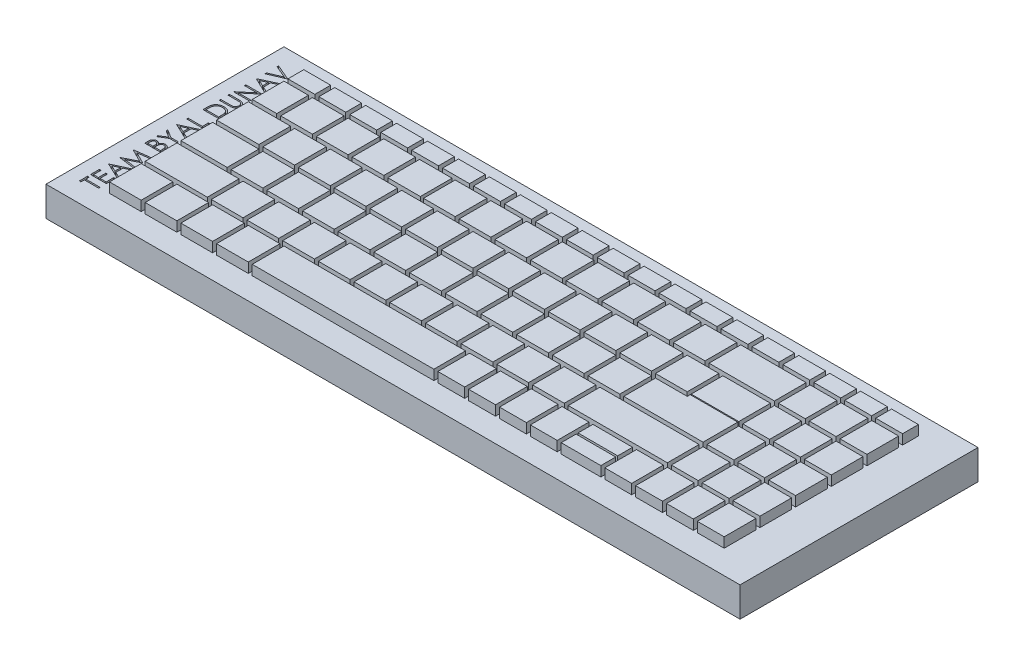
from build123d import *

# Parameters (mm, degrees)
SKETCH2_W           = 350
SKETCH2_H           = 120
BOSS_EXTRUDE1_DEPTH = 15
SKETCH3_W           = 13.55
SKETCH3_H           = 8
SKETCH3_W_2         = 12.35
SKETCH3_H_2         = 16
SKETCH3_W_3         = 21.35
SKETCH3_W_4         = 16
SKETCH3_W_5         = 33
SKETCH3_W_6         = 16.425
SKETCH3_W_7         = 24
BOSS_EXTRUDE2_DEPTH = 5
SKETCH4_W           = 16
SKETCH4_H           = 16
SKETCH4_W_2         = 23.35
BOSS_EXTRUDE3_DEPTH = 5
SKETCH5_W           = 50
SKETCH5_H           = 16
SKETCH5_W_2         = 16
SKETCH5_W_3         = 31.35
BOSS_EXTRUDE4_DEPTH = 5
SKETCH8_W           = 13.55
SKETCH8_H           = 16
SKETCH8_W_2         = 20
SKETCH8_H_2         = 7.5
SKETCH8_W_3         = 91.6
SKETCH8_W_4         = 16
BOSS_EXTRUDE5_DEPTH = 5
CUT_EXTRUDE5_DEPTH  = 5


with BuildPart() as part:
    # Sketch2 → Boss-Extrude1 (new body)
    with BuildSketch(Plane(origin=(0, 0, 0), x_dir=(1, 0, 0), z_dir=(0, 1, 0))):
        Rectangle(SKETCH2_W, SKETCH2_H)
    extrude(amount=BOSS_EXTRUDE1_DEPTH)

    # Sketch3 → Boss-Extrude2 (add)
    with BuildSketch(Plane(origin=(0, 15, 0), x_dir=(1, 0, 0), z_dir=(0, 1, 0))):
        with Locations((-132.625, 46)):
            Rectangle(SKETCH3_W, SKETCH3_H)
        with Locations((-117.025, 46)):
            Rectangle(SKETCH3_W, SKETCH3_H)
        with Locations((-148.225, 46)):
            Rectangle(SKETCH3_W, SKETCH3_H)
        with Locations((-101.425, 46)):
            Rectangle(SKETCH3_W, SKETCH3_H)
        with Locations((-85.825, 46)):
            Rectangle(SKETCH3_W, SKETCH3_H)
        with Locations((-148.825, 32)):
            Rectangle(SKETCH3_W_2, SKETCH3_H_2)
        with Locations((-70.225, 46)):
            Rectangle(SKETCH3_W, SKETCH3_H)
        with Locations((-144.325, 14)):
            Rectangle(SKETCH3_W_3, SKETCH3_H_2)
        with Locations((-54.625, 46)):
            Rectangle(SKETCH3_W, SKETCH3_H)
        with Locations((-39.025, 46)):
            Rectangle(SKETCH3_W, SKETCH3_H)
        with Locations((148.225, -40)):
            Rectangle(SKETCH3_W, SKETCH3_H_2)
        with Locations((-23.425, 46)):
            Rectangle(SKETCH3_W, SKETCH3_H)
        with Locations((148.225, -22)):
            Rectangle(SKETCH3_W, SKETCH3_H_2)
        with Locations((-7.825, 46)):
            Rectangle(SKETCH3_W, SKETCH3_H)
        with Locations((148.225, -4)):
            Rectangle(SKETCH3_W, SKETCH3_H_2)
        with Locations((7.774999999, 46)):
            Rectangle(SKETCH3_W, SKETCH3_H)
        with Locations((148.225, 14)):
            Rectangle(SKETCH3_W, SKETCH3_H_2)
        with Locations((23.374999999, 46)):
            Rectangle(SKETCH3_W, SKETCH3_H)
        with Locations((148.225, 32)):
            Rectangle(SKETCH3_W, SKETCH3_H_2)
        with Locations((38.974999999, 46)):
            Rectangle(SKETCH3_W, SKETCH3_H)
        with Locations((148.174999999, 46)):
            Rectangle(SKETCH3_W, SKETCH3_H)
        with Locations((54.574999999, 46)):
            Rectangle(SKETCH3_W, SKETCH3_H)
        with Locations((132.574999999, 46)):
            Rectangle(SKETCH3_W, SKETCH3_H)
        with Locations((70.174999999, 46)):
            Rectangle(SKETCH3_W, SKETCH3_H)
        with Locations((116.974999999, 46)):
            Rectangle(SKETCH3_W, SKETCH3_H)
        with Locations((85.774999999, 46)):
            Rectangle(SKETCH3_W, SKETCH3_H)
        with Locations((101.374999999, 46)):
            Rectangle(SKETCH3_W, SKETCH3_H)
        with Locations((47.35, 32)):
            Rectangle(SKETCH3_W_4, SKETCH3_H_2)
        with Locations((132.675, 32)):
            Rectangle(SKETCH3_W, SKETCH3_H_2)
        with Locations((117.125, 32)):
            Rectangle(SKETCH3_W, SKETCH3_H_2)
        with Locations((91.85, 32)):
            Rectangle(SKETCH3_W_5, SKETCH3_H_2)
        with Locations((65.35, 32)):
            Rectangle(SKETCH3_W_4, SKETCH3_H_2)
        with Locations((29.35, 32)):
            Rectangle(SKETCH3_W_4, SKETCH3_H_2)
        with Locations((11.35, 32)):
            Rectangle(SKETCH3_W_4, SKETCH3_H_2)
        with Locations((-6.65, 32)):
            Rectangle(SKETCH3_W_4, SKETCH3_H_2)
        with Locations((-24.65, 32)):
            Rectangle(SKETCH3_W_4, SKETCH3_H_2)
        with Locations((-42.65, 32)):
            Rectangle(SKETCH3_W_4, SKETCH3_H_2)
        with Locations((-60.65, 32)):
            Rectangle(SKETCH3_W_4, SKETCH3_H_2)
        with Locations((-78.4375, 32)):
            Rectangle(SKETCH3_W_6, SKETCH3_H_2)
        with Locations((-96.65, 32)):
            Rectangle(SKETCH3_W_4, SKETCH3_H_2)
        with Locations((-114.65, 32)):
            Rectangle(SKETCH3_W_4, SKETCH3_H_2)
        with Locations((-132.65, 32)):
            Rectangle(SKETCH3_W_4, SKETCH3_H_2)
        with Locations((117.125, 14)):
            Rectangle(SKETCH3_W, SKETCH3_H_2)
        with Locations((132.675, 14)):
            Rectangle(SKETCH3_W, SKETCH3_H_2)
        with Locations((117.125, -4)):
            Rectangle(SKETCH3_W, SKETCH3_H_2)
        with Locations((132.675, -4)):
            Rectangle(SKETCH3_W, SKETCH3_H_2)
        with Locations((117.125, -22)):
            Rectangle(SKETCH3_W, SKETCH3_H_2)
        with Locations((132.675, -22)):
            Rectangle(SKETCH3_W, SKETCH3_H_2)
        with Locations((117.125, -40)):
            Rectangle(SKETCH3_W, SKETCH3_H_2)
        with Locations((132.675, -40)):
            Rectangle(SKETCH3_W, SKETCH3_H_2)
        with Locations((56.35, 14)):
            Rectangle(SKETCH3_W_4, SKETCH3_H_2)
        with Locations((96.35, 14)):
            Rectangle(SKETCH3_W_7, SKETCH3_H_2)
        with Locations((74.35, 14)):
            Rectangle(SKETCH3_W_4, SKETCH3_H_2)
        with Locations((38.35, 14)):
            Rectangle(SKETCH3_W_4, SKETCH3_H_2)
        with Locations((20.35, 14)):
            Rectangle(SKETCH3_W_4, SKETCH3_H_2)
        with Locations((2.35, 14)):
            Rectangle(SKETCH3_W_4, SKETCH3_H_2)
        with Locations((-15.65, 14)):
            Rectangle(SKETCH3_W_4, SKETCH3_H_2)
        with Locations((-33.65, 14)):
            Rectangle(SKETCH3_W_4, SKETCH3_H_2)
        with Locations((-51.65, 14)):
            Rectangle(SKETCH3_W_4, SKETCH3_H_2)
        with Locations((-69.65, 14)):
            Rectangle(SKETCH3_W_4, SKETCH3_H_2)
        with Locations((-87.65, 14)):
            Rectangle(SKETCH3_W_4, SKETCH3_H_2)
        with Locations((-105.65, 14)):
            Rectangle(SKETCH3_W_4, SKETCH3_H_2)
        with Locations((-123.65, 14)):
            Rectangle(SKETCH3_W_4, SKETCH3_H_2)
    extrude(amount=BOSS_EXTRUDE2_DEPTH)

    # Sketch4 → Boss-Extrude3 (add)
    with BuildSketch(Plane(origin=(0, 15, 0), x_dir=(1, 0, 0), z_dir=(0, 1, 0))):
        Polygon((84.35, 4), (68.35, 4), (68.35, -12), (108.35, -12), (108.35, 4), (108.35, 5.49921677), (84.35, 5.49921677), align=None)
        with Locations((40.35, -4)):
            Rectangle(SKETCH4_W, SKETCH4_H)
        with Locations((58.35, -4)):
            Rectangle(SKETCH4_W, SKETCH4_H)
        with Locations((22.35, -4)):
            Rectangle(SKETCH4_W, SKETCH4_H)
        with Locations((4.35, -4)):
            Rectangle(SKETCH4_W, SKETCH4_H)
        with Locations((-13.65, -4)):
            Rectangle(SKETCH4_W, SKETCH4_H)
        with Locations((-31.65, -4)):
            Rectangle(SKETCH4_W, SKETCH4_H)
        with Locations((-49.65, -4)):
            Rectangle(SKETCH4_W, SKETCH4_H)
        with Locations((-67.65, -4)):
            Rectangle(SKETCH4_W, SKETCH4_H)
        with Locations((-85.65, -4)):
            Rectangle(SKETCH4_W, SKETCH4_H)
        with Locations((-103.65, -4)):
            Rectangle(SKETCH4_W, SKETCH4_H)
        with Locations((-121.65, -4)):
            Rectangle(SKETCH4_W, SKETCH4_H)
        with Locations((-143.325, -4)):
            Rectangle(SKETCH4_W_2, SKETCH4_H)
    extrude(amount=BOSS_EXTRUDE3_DEPTH)

    # Sketch5 → Boss-Extrude4 (add)
    with BuildSketch(Plane(origin=(0, 15, 0), x_dir=(1, 0, 0), z_dir=(0, 1, 0))):
        with Locations((83.35, -22)):
            Rectangle(SKETCH5_W, SKETCH5_H)
        with Locations((30.35, -22)):
            Rectangle(SKETCH5_W_2, SKETCH5_H)
        with Locations((48.35, -22)):
            Rectangle(SKETCH5_W_2, SKETCH5_H)
        with Locations((12.35, -22)):
            Rectangle(SKETCH5_W_2, SKETCH5_H)
        with Locations((-5.65, -22)):
            Rectangle(SKETCH5_W_2, SKETCH5_H)
        with Locations((-23.65, -22)):
            Rectangle(SKETCH5_W_2, SKETCH5_H)
        with Locations((-41.65, -22)):
            Rectangle(SKETCH5_W_2, SKETCH5_H)
        with Locations((-59.65, -22)):
            Rectangle(SKETCH5_W_2, SKETCH5_H)
        with Locations((-77.65, -22)):
            Rectangle(SKETCH5_W_2, SKETCH5_H)
        with Locations((-95.65, -22)):
            Rectangle(SKETCH5_W_2, SKETCH5_H)
        with Locations((-113.65, -22)):
            Rectangle(SKETCH5_W_2, SKETCH5_H)
        with Locations((-139.325, -22)):
            Rectangle(SKETCH5_W_3, SKETCH5_H)
    extrude(amount=BOSS_EXTRUDE4_DEPTH)

    # Sketch8 → Boss-Extrude5 (add)
    with BuildSketch(Plane(origin=(0, 15, 0), x_dir=(1, 0, 0), z_dir=(0, 1, 0))):
        with Locations((101.575, -40)):
            Rectangle(SKETCH8_W, SKETCH8_H)
        with Locations((48.475, -40)):
            Rectangle(SKETCH8_W, SKETCH8_H)
        with Locations((82.8, -35.75)):
            Rectangle(SKETCH8_W_2, SKETCH8_H_2)
        with Locations((82.8, -44.25)):
            Rectangle(SKETCH8_W_2, SKETCH8_H_2)
        with Locations((64.025, -40)):
            Rectangle(SKETCH8_W, SKETCH8_H)
        with Locations((32.925, -40)):
            Rectangle(SKETCH8_W, SKETCH8_H)
        with Locations((17.375, -40)):
            Rectangle(SKETCH8_W, SKETCH8_H)
        with Locations((-37.2, -40)):
            Rectangle(SKETCH8_W_3, SKETCH8_H)
        with Locations((-129, -40)):
            Rectangle(SKETCH8_W_4, SKETCH8_H)
        with Locations((-147, -40)):
            Rectangle(SKETCH8_W_4, SKETCH8_H)
        with Locations((-111, -40)):
            Rectangle(SKETCH8_W_4, SKETCH8_H)
        with Locations((-93, -40)):
            Rectangle(SKETCH8_W_4, SKETCH8_H)
    extrude(amount=BOSS_EXTRUDE5_DEPTH)

    # Sketch16 → Cut-Extrude5 (cut)
    # profile 1 of 13: a face of its own
    with BuildSketch(Plane(origin=(0, 15, 0), x_dir=(1, 0, 0), z_dir=(0, 1, 0))):
        Polygon((-168, 43.435897436), (-168, 44.205128205), (-161.695512821, 46.871794872), (-168, 49.538461538), (-168, 50.307692308), (-160, 46.923076923), (-160, 46.820512821), align=None)
    # profile 2 of 13: a face of its own
    with BuildSketch(Plane(origin=(0, 15, 0), x_dir=(1, 0, 0), z_dir=(0, 1, 0))):
        Polygon((-168, 39.128205128), (-160, 42.820512821), (-160, 42.040064103), (-162.564102564, 40.857371795), (-162.564102564, 37.230769231), (-160, 36.014423077), (-160, 35.230769231), (-168, 39.025641026), align=None)
        Polygon((-166.440705128, 39.068910256), (-163.384615385, 37.620192308), (-163.384615385, 40.479166667), align=None, mode=Mode.SUBTRACT)
    # profile 3 of 13: a face of its own
    with BuildSketch(Plane(origin=(0, 15, 0), x_dir=(1, 0, 0), z_dir=(0, 1, 0))):
        Polygon((-160, 27.641025641), (-168, 27.641025641), (-168, 27.791666667), (-161.703525641, 33.076923077), (-168, 33.076923077), (-168, 33.794871795), (-160, 33.794871795), (-160, 33.631410256), (-166.282051282, 28.358974359), (-160, 28.358974359), align=None)
    # profile 4 of 13: a face of its own
    with BuildSketch(Plane(origin=(0, 15, 0), x_dir=(1, 0, 0), z_dir=(0, 1, 0))):
        with BuildLine():
            Line((-168, 20.358974359), (-168, 21.076923077))
            Line((-168, 21.076923077), (-163.206730769, 21.076923077))
            add(Edge.make_bspline(
                [(-163.206730769, 21.076923077), (-163.138889088, 21.076816234), (-163.010147805, 21.07661348), (-162.826905976, 21.077967797), (-162.663997498, 21.081760639), (-162.520794418, 21.084151861), (-162.397953852, 21.089471481), (-162.294810285, 21.093809874), (-162.211852108, 21.099388289), (-162.163438562, 21.106092558), (-162.142628205, 21.108974359)],
                knots=[0, 0, 0, 0, 1.528628734, 2.90083645, 4.128790002, 5.200304208, 6.127813768, 6.898992206, 7.526736466, 8, 8, 8, 8], degree=3))
            add(Edge.make_bspline(
                [(-162.142628205, 21.108974359), (-162.066974247, 21.120673749), (-161.920927682, 21.143258896), (-161.713104437, 21.203263415), (-161.525458912, 21.283259106), (-161.353758487, 21.382498544), (-161.199094336, 21.507888004), (-161.060279395, 21.663562891), (-160.934131896, 21.846732163), (-160.824149413, 22.054771542), (-160.732799693, 22.276437865), (-160.664446658, 22.503784397), (-160.622614644, 22.732423355), (-160.617783612, 22.885515756), (-160.615384615, 22.961538462)],
                knots=[0, 0, 0, 0, 1.042777144, 2.01303441, 2.939567723, 3.817555404, 4.708046775, 5.641195415, 6.651191522, 7.732783915, 8.843021186, 9.914367358, 10.964315445, 12, 12, 12, 12], degree=3))
            add(Edge.make_bspline(
                [(-160.615384615, 22.961538462), (-160.617825524, 23.026809892), (-160.622693244, 23.156975762), (-160.653207727, 23.350276432), (-160.707118043, 23.539135144), (-160.780553735, 23.722068249), (-160.870859951, 23.896102773), (-160.979045328, 24.056776692), (-161.105060341, 24.200766612), (-161.244719756, 24.332165438), (-161.402099767, 24.445914414), (-161.573403563, 24.546486294), (-161.763198883, 24.626358857), (-161.896502149, 24.666798093), (-161.96474359, 24.6875)],
                knots=[0, 0, 0, 0, 0.994718802, 1.98369237, 2.973235266, 3.981451368, 4.982709966, 5.955777334, 6.925228988, 7.892833478, 8.871333226, 9.877970804, 10.913677552, 12, 12, 12, 12], degree=3))
            add(Edge.make_bspline(
                [(-161.96474359, 24.6875), (-161.992968903, 24.694357429), (-162.055866274, 24.709638545), (-162.162200653, 24.723917505), (-162.287662056, 24.738789563), (-162.433151914, 24.74910858), (-162.598182708, 24.759168513), (-162.783614154, 24.765186965), (-162.988772922, 24.767968754), (-163.131943577, 24.768797738), (-163.206730769, 24.769230769)],
                knots=[0, 0, 0, 0, 0.558680831, 1.244966039, 2.062412453, 2.990489873, 4.051219941, 5.244515665, 6.560634259, 8, 8, 8, 8], degree=3))
            Line((-163.206730769, 24.769230769), (-168, 24.769230769))
            Line((-168, 24.769230769), (-168, 25.487179487))
            Line((-168, 25.487179487), (-163.168269231, 25.487179487))
            add(Edge.make_bspline(
                [(-163.168269231, 25.487179487), (-163.081187239, 25.486598558), (-162.911241437, 25.485464839), (-162.66220952, 25.475636099), (-162.425974981, 25.459958898), (-162.202501225, 25.437828632), (-161.992604548, 25.4084391), (-161.794902412, 25.376058537), (-161.610484817, 25.33410132), (-161.43722406, 25.285456472), (-161.271462593, 25.230640372), (-161.11445488, 25.158396236), (-160.961589591, 25.077354638), (-160.814578409, 24.982013468), (-160.674355361, 24.872327602), (-160.537290608, 24.752499232), (-160.407469049, 24.618304755), (-160.283289544, 24.473707855), (-160.167802572, 24.319680733), (-160.067302726, 24.155228838), (-159.985468601, 23.981260092), (-159.912839201, 23.801893949), (-159.861216075, 23.612829999), (-159.821964653, 23.416423302), (-159.799849306, 23.211508873), (-159.796545031, 23.072164504), (-159.794871795, 23.001602564)],
                knots=[0, 0, 0, 0, 1.316707045, 2.569633854, 3.76780728, 4.896239288, 5.964314126, 6.972204208, 7.924543903, 8.822147865, 9.693191779, 10.560896119, 11.431827672, 12.307838457, 13.206132673, 14.12176355, 15.058527151, 16.026630406, 17.00238624, 17.966538933, 18.934743273, 19.906713913, 20.888635248, 21.892958714, 22.933025263, 24, 24, 24, 24], degree=3))
            add(Edge.make_bspline(
                [(-159.794871795, 23.001602564), (-159.796664301, 22.924644053), (-159.800181191, 22.77365173), (-159.820365084, 22.55117268), (-159.858285827, 22.337854077), (-159.906883109, 22.131613986), (-159.972813403, 21.934444918), (-160.05382415, 21.746404975), (-160.146310225, 21.565335068), (-160.255597106, 21.395314658), (-160.374767092, 21.234949014), (-160.505662256, 21.089213311), (-160.643297438, 20.954408035), (-160.792855296, 20.836475102), (-160.951274243, 20.730953896), (-161.119299397, 20.64016963), (-161.296705513, 20.56218912), (-161.420028089, 20.52194654), (-161.482371795, 20.501602564)],
                knots=[0, 0, 0, 0, 1.138939089, 2.234594419, 3.301501784, 4.342532435, 5.367382236, 6.373123747, 7.370098489, 8.372230273, 9.360297234, 10.323289009, 11.268038109, 12.20748145, 13.137029304, 14.081414587, 15.030090602, 16, 16, 16, 16], degree=3))
            add(Edge.make_bspline(
                [(-161.482371795, 20.501602564), (-161.524960536, 20.48976906), (-161.617336465, 20.464101925), (-161.770219868, 20.436615531), (-161.946253965, 20.413509058), (-162.145450807, 20.391782068), (-162.367964788, 20.378961593), (-162.613699453, 20.367721733), (-162.882951937, 20.358895176), (-163.070505115, 20.358947227), (-163.168269231, 20.358974359)],
                knots=[0, 0, 0, 0, 0.625038921, 1.35572334, 2.194682327, 3.136881307, 4.189498639, 5.346923369, 6.617055217, 8, 8, 8, 8], degree=3))
            Line((-163.168269231, 20.358974359), (-168, 20.358974359))
        make_face()
    # profile 5 of 13: a face of its own
    with BuildSketch(Plane(origin=(0, 15, 0), x_dir=(1, 0, 0), z_dir=(0, 1, 0))):
        with BuildLine():
            Line((-160, 12.153846154), (-168, 12.153846154))
            Line((-168, 12.153846154), (-168, 13.769230769))
            add(Edge.make_bspline(
                [(-168, 13.769230769), (-167.998988411, 13.909731314), (-167.997034028, 14.181177634), (-167.984642276, 14.573434657), (-167.962721212, 14.936368971), (-167.930790866, 15.268786935), (-167.891583932, 15.571601134), (-167.842440151, 15.843963667), (-167.784410047, 16.08728285), (-167.734934732, 16.236927286), (-167.711538462, 16.307692308)],
                knots=[0, 0, 0, 0, 1.314313732, 2.53924729, 3.670748893, 4.714932338, 5.66265055, 6.526160246, 7.303039223, 8, 8, 8, 8], degree=3))
            add(Edge.make_bspline(
                [(-167.711538462, 16.307692308), (-167.676279261, 16.400260048), (-167.606560421, 16.583296399), (-167.474843711, 16.843763093), (-167.326215941, 17.089798963), (-167.157256773, 17.319442391), (-166.970172532, 17.53326958), (-166.766299745, 17.733707404), (-166.541109464, 17.915814065), (-166.298609945, 18.082425877), (-166.041908288, 18.23268859), (-165.771424904, 18.363289738), (-165.488552137, 18.471756726), (-165.194071566, 18.56179819), (-164.887337053, 18.632761576), (-164.567991055, 18.681177405), (-164.23729577, 18.7131111), (-164.012896995, 18.71632036), (-163.899038462, 18.717948718)],
                knots=[0, 0, 0, 0, 0.984741985, 1.947153288, 2.898543998, 3.841229145, 4.778974371, 5.722123648, 6.681464302, 7.655713756, 8.646344578, 9.637374342, 10.639946623, 11.656849581, 12.698333139, 13.76849723, 14.867749466, 16, 16, 16, 16], degree=3))
            add(Edge.make_bspline(
                [(-163.899038462, 18.717948718), (-163.800155632, 18.716511077), (-163.605296687, 18.713678055), (-163.318117484, 18.688239635), (-163.03945794, 18.651265131), (-162.77064474, 18.594021461), (-162.509323721, 18.524529235), (-162.258276312, 18.435471128), (-162.015213101, 18.333436834), (-161.783371008, 18.214503572), (-161.563863473, 18.083757049), (-161.356783315, 17.944319806), (-161.166725711, 17.793029512), (-160.98871029, 17.634363903), (-160.827492534, 17.464496779), (-160.680133659, 17.285496248), (-160.549100773, 17.096666666), (-160.43233482, 16.896839124), (-160.327914259, 16.683344875), (-160.240814983, 16.449468443), (-160.165378117, 16.196317655), (-160.105368087, 15.922448856), (-160.056969568, 15.628838852), (-160.024745647, 15.314673161), (-160.002891742, 14.980545514), (-160.00098263, 14.7511064), (-160, 14.633012821)],
                knots=[0, 0, 0, 0, 1.106010661, 2.179509527, 3.223302912, 4.248870533, 5.252098245, 6.246278179, 7.226402005, 8.199283979, 9.158616973, 10.083547221, 10.989831858, 11.874256832, 12.749262829, 13.607058236, 14.46581075, 15.317568432, 16.194266721, 17.121067875, 18.106207572, 19.147242834, 20.255495536, 21.43354536, 22.679031616, 24, 24, 24, 24], degree=3))
            Line((-160, 14.633012821), (-160, 12.153846154))
        make_face()
        with BuildLine():
            Line((-160.820512821, 12.871794872), (-160.820512821, 13.790064103))
            add(Edge.make_bspline(
                [(-160.820512821, 13.790064103), (-160.821079898, 13.922014664), (-160.822170596, 14.175803918), (-160.831741346, 14.540736483), (-160.84738006, 14.874175104), (-160.869265952, 15.176167125), (-160.898222787, 15.446542038), (-160.930508279, 15.685864895), (-160.970731023, 15.893351199), (-161.007190359, 16.018904198), (-161.024038462, 16.076923077)],
                knots=[0, 0, 0, 0, 1.375205317, 2.645023457, 3.804390687, 4.853969522, 5.800190428, 6.637939096, 7.370582563, 8, 8, 8, 8], degree=3))
            add(Edge.make_bspline(
                [(-161.024038462, 16.076923077), (-161.049756304, 16.149947912), (-161.100577719, 16.294253386), (-161.193281014, 16.501981471), (-161.303091204, 16.695712172), (-161.425154479, 16.878819322), (-161.563770422, 17.048714342), (-161.715945788, 17.207377298), (-161.88237583, 17.35461394), (-162.062790673, 17.488156425), (-162.255233937, 17.609115183), (-162.460045973, 17.712953203), (-162.674347431, 17.803382515), (-162.899873205, 17.874986153), (-163.13497031, 17.931442485), (-163.380857827, 17.971015217), (-163.637318171, 17.995582567), (-163.811909715, 17.998511468), (-163.900641026, 18)],
                knots=[0, 0, 0, 0, 0.998590647, 1.973329978, 2.929871262, 3.868367705, 4.809062953, 5.754642869, 6.701828697, 7.672172887, 8.647399344, 9.630604387, 10.631475358, 11.644913558, 12.679592956, 13.747988925, 14.855477812, 16, 16, 16, 16], degree=3))
            add(Edge.make_bspline(
                [(-163.900641026, 18), (-163.994203266, 17.998826772), (-164.178007116, 17.996521954), (-164.447700134, 17.967552102), (-164.707084478, 17.925217118), (-164.956177496, 17.863997264), (-165.195465158, 17.785983827), (-165.423624039, 17.688624646), (-165.643063739, 17.577386659), (-165.848719432, 17.445036175), (-166.043217967, 17.300086247), (-166.221400631, 17.139222523), (-166.383673318, 16.96500072), (-166.532563175, 16.779321064), (-166.662080149, 16.576950552), (-166.77793542, 16.362656402), (-166.876257457, 16.133294867), (-166.928552001, 15.973722991), (-166.955128205, 15.892628205)],
                knots=[0, 0, 0, 0, 1.122418816, 2.205001699, 3.251619955, 4.274784885, 5.280384055, 6.268708349, 7.249350384, 8.229342522, 9.199999885, 10.157847722, 11.105861043, 12.055065948, 13.010012805, 13.98527497, 14.976112212, 16, 16, 16, 16], degree=3))
            add(Edge.make_bspline(
                [(-166.955128205, 15.892628205), (-166.97368004, 15.825539871), (-167.013126332, 15.682891664), (-167.056155755, 15.450115746), (-167.094108895, 15.188138262), (-167.126241557, 14.895796088), (-167.149298291, 14.573422467), (-167.166604153, 14.220769466), (-167.178276456, 13.837684656), (-167.179073501, 13.572124578), (-167.179487179, 13.434294872)],
                knots=[0, 0, 0, 0, 0.674548936, 1.434276114, 2.292660221, 3.240891867, 4.284742987, 5.42552168, 6.663806718, 8, 8, 8, 8], degree=3))
            Line((-167.179487179, 13.434294872), (-167.179487179, 12.871794872))
            Line((-167.179487179, 12.871794872), (-160.820512821, 12.871794872))
        make_face(mode=Mode.SUBTRACT)
    # profile 6 of 13: a face of its own
    with BuildSketch(Plane(origin=(0, 15, 0), x_dir=(1, 0, 0), z_dir=(0, 1, 0))):
        Polygon((-168, 3.948717949), (-168, 4.666666667), (-160.820512821, 4.666666667), (-160.820512821, 7.743589744), (-160, 7.743589744), (-160, 3.948717949), align=None)
    # profile 7 of 13: a face of its own
    with BuildSketch(Plane(origin=(0, 15, 0), x_dir=(1, 0, 0), z_dir=(0, 1, 0))):
        Polygon((-168, -0.974358974), (-160, 2.717948718), (-160, 1.9375), (-162.564102564, 0.754807692), (-162.564102564, -2.871794872), (-160, -4.088141026), (-160, -4.871794872), (-168, -1.076923077), align=None)
        Polygon((-166.440705128, -1.033653846), (-163.384615385, -2.482371795), (-163.384615385, 0.376602564), align=None, mode=Mode.SUBTRACT)
    # profile 8 of 13: a face of its own
    with BuildSketch(Plane(origin=(0, 15, 0), x_dir=(1, 0, 0), z_dir=(0, 1, 0))):
        Polygon((-168, -11.435897436), (-168, -10.613782051), (-164.5625, -8.511217949), (-168, -6.411858974), (-168, -5.58974359), (-163.802884615, -8.153846154), (-160, -8.153846154), (-160, -8.871794872), (-163.802884615, -8.871794872), align=None)
    # profile 9 of 13: a face of its own
    with BuildSketch(Plane(origin=(0, 15, 0), x_dir=(1, 0, 0), z_dir=(0, 1, 0))):
        with BuildLine():
            Line((-168, -17.179487179), (-168, -15.618589744))
            add(Edge.make_bspline(
                [(-168, -15.618589744), (-167.999604609, -15.542180588), (-167.998838243, -15.394080629), (-167.986676567, -15.178738281), (-167.97050877, -14.976969984), (-167.943388159, -14.789132287), (-167.915267664, -14.614002959), (-167.873993509, -14.453359931), (-167.8284047, -14.305857616), (-167.758260132, -14.128737527), (-167.649324733, -13.927770516), (-167.487763184, -13.711768583), (-167.294063933, -13.524006524), (-167.073328358, -13.364353117), (-166.830494212, -13.236227862), (-166.57078615, -13.144707555), (-166.298573449, -13.085911424), (-166.111946474, -13.079940623), (-166.017628205, -13.076923077)],
                knots=[0, 0, 0, 0, 1.00128172, 1.940733171, 2.826250472, 3.653024905, 4.427672124, 5.149348099, 5.824709082, 6.450061444, 7.643590664, 8.808605388, 9.972104426, 11.165284501, 12.367876273, 13.557044126, 14.765369432, 16, 16, 16, 16], degree=3))
            add(Edge.make_bspline(
                [(-166.017628205, -13.076923077), (-165.929283391, -13.079436473), (-165.7556775, -13.084375533), (-165.502196721, -13.131029179), (-165.261151319, -13.205075184), (-165.032747591, -13.30740975), (-164.821237294, -13.439262111), (-164.627275627, -13.597239774), (-164.458193276, -13.787048674), (-164.363702275, -13.929330065), (-164.315705128, -14.001602564)],
                knots=[0, 0, 0, 0, 1.044641374, 2.052818814, 3.038628718, 4.023282556, 5.005660861, 5.98021751, 6.974042014, 8, 8, 8, 8], degree=3))
            add(Edge.make_bspline(
                [(-164.315705128, -14.001602564), (-164.280802404, -13.910730362), (-164.214024846, -13.73686933), (-164.096147506, -13.497473164), (-163.967473121, -13.291970337), (-163.829125175, -13.116346455), (-163.677801452, -12.966935991), (-163.512272516, -12.83753789), (-163.332673879, -12.725670711), (-163.139665623, -12.630472514), (-162.934883966, -12.555693144), (-162.720830115, -12.500731343), (-162.498324644, -12.468220244), (-162.347327976, -12.463785231), (-162.270833333, -12.461538462)],
                knots=[0, 0, 0, 0, 1.272586185, 2.434772614, 3.483318042, 4.437947805, 5.351807173, 6.25737843, 7.180033415, 8.1141739, 9.066731021, 10.025721652, 10.999834114, 12, 12, 12, 12], degree=3))
            add(Edge.make_bspline(
                [(-162.270833333, -12.461538462), (-162.192737308, -12.463770764), (-162.03908119, -12.468162883), (-161.813359707, -12.500581218), (-161.597628861, -12.555433558), (-161.390592679, -12.631119007), (-161.192685245, -12.729219947), (-161.004623509, -12.850331048), (-160.826016214, -12.992752155), (-160.656548137, -13.153711026), (-160.50147952, -13.333087096), (-160.368172804, -13.53077107), (-160.253548027, -13.741347371), (-160.16022462, -13.967508015), (-160.088225674, -14.208675662), (-160.038062213, -14.464716113), (-160.004205433, -14.735207707), (-160.001425597, -14.920831354), (-160, -15.016025641)],
                knots=[0, 0, 0, 0, 0.978680899, 1.925582087, 2.851223405, 3.764209995, 4.683484765, 5.614004905, 6.562443559, 7.542772147, 8.539900013, 9.527881485, 10.525548727, 11.540192123, 12.58875426, 13.674701727, 14.807505862, 16, 16, 16, 16], degree=3))
            Line((-160, -15.016025641), (-160, -17.179487179))
            Line((-160, -17.179487179), (-168, -17.179487179))
        make_face()
        with BuildLine():
            Line((-167.179487179, -16.461538462), (-164.615384615, -16.461538462))
            Line((-164.615384615, -16.461538462), (-164.615384615, -15.979166667))
            add(Edge.make_bspline(
                [(-164.615384615, -15.979166667), (-164.616298725, -15.908655134), (-164.618064971, -15.772412484), (-164.62312444, -15.575109866), (-164.637291391, -15.39196696), (-164.651454295, -15.223299936), (-164.674481859, -15.069374274), (-164.70189264, -14.930531411), (-164.730881445, -14.804590955), (-164.780186051, -14.659361109), (-164.853029482, -14.494599871), (-164.966186292, -14.319072484), (-165.100857183, -14.163612333), (-165.257702254, -14.033909242), (-165.428534115, -13.926819975), (-165.611853024, -13.851800576), (-165.803969924, -13.801787376), (-165.936113094, -13.797200602), (-166.003205128, -13.794871795)],
                knots=[0, 0, 0, 0, 1.156917035, 2.235399477, 3.236897345, 4.169954739, 5.01148057, 5.788325709, 6.491867502, 7.129259015, 8.302032419, 9.437271567, 10.542795419, 11.662606952, 12.764338259, 13.836858145, 14.901724648, 16, 16, 16, 16], degree=3))
            add(Edge.make_bspline(
                [(-166.003205128, -13.794871795), (-166.047612712, -13.79605422), (-166.134723038, -13.798373676), (-166.262122336, -13.81806013), (-166.381830948, -13.84995741), (-166.494997774, -13.893154926), (-166.598810348, -13.952169143), (-166.698229103, -14.020574373), (-166.787299342, -14.105030343), (-166.870309252, -14.200473087), (-166.944602845, -14.309676609), (-167.006143572, -14.434993701), (-167.061919917, -14.573184726), (-167.103209488, -14.727998881), (-167.139517191, -14.896228363), (-167.162329565, -15.080151064), (-167.177009544, -15.278601502), (-167.17864288, -15.41610273), (-167.179487179, -15.487179487)],
                knots=[0, 0, 0, 0, 0.911708768, 1.788416306, 2.640049961, 3.452993646, 4.268229297, 5.087074648, 5.92553149, 6.781184137, 7.681934069, 8.628939405, 9.643570426, 10.73771997, 11.914765019, 13.176320755, 14.540391495, 16, 16, 16, 16], degree=3))
            Line((-167.179487179, -15.487179487), (-167.179487179, -16.461538462))
        make_face(mode=Mode.SUBTRACT)
        with BuildLine():
            Line((-163.794871795, -16.461538462), (-160.820512821, -16.461538462))
            Line((-160.820512821, -16.461538462), (-160.820512821, -15.439102564))
            add(Edge.make_bspline(
                [(-160.820512821, -15.439102564), (-160.821477174, -15.365924102), (-160.823335839, -15.224882264), (-160.827694795, -15.021081714), (-160.844184062, -14.832683027), (-160.859395336, -14.659091873), (-160.885405961, -14.500768964), (-160.909953229, -14.35649647), (-160.946391895, -14.228642724), (-160.996472553, -14.079024262), (-161.076645471, -13.911785403), (-161.193777346, -13.729023434), (-161.338336163, -13.569657829), (-161.50274444, -13.432857334), (-161.681013183, -13.319963624), (-161.870811869, -13.238951709), (-162.068449274, -13.188608016), (-162.203236173, -13.182533579), (-162.270833333, -13.179487179)],
                knots=[0, 0, 0, 0, 1.160376723, 2.23647316, 3.230273494, 4.158083346, 4.997711197, 5.773399541, 6.476071462, 7.102777513, 8.27340052, 9.405620712, 10.53304798, 11.669441455, 12.787990954, 13.865552736, 14.929550474, 16, 16, 16, 16], degree=3))
            add(Edge.make_bspline(
                [(-162.270833333, -13.179487179), (-162.313104736, -13.180116342), (-162.396965701, -13.18136452), (-162.520188586, -13.200274102), (-162.639611048, -13.227630275), (-162.75573074, -13.263659142), (-162.86659526, -13.314025555), (-162.972629777, -13.375770557), (-163.075970321, -13.446448681), (-163.208306839, -13.555491659), (-163.358887439, -13.716411277), (-163.504494075, -13.945096011), (-163.623817304, -14.203682961), (-163.674262057, -14.391671849), (-163.700320513, -14.488782051)],
                knots=[0, 0, 0, 0, 0.723302347, 1.434937762, 2.129609326, 2.821140842, 3.513216847, 4.209993937, 4.920569932, 5.655069131, 7.14393391, 8.6716197, 10.280644748, 12, 12, 12, 12], degree=3))
            add(Edge.make_bspline(
                [(-163.700320513, -14.488782051), (-163.708217848, -14.527705699), (-163.725340898, -14.612100196), (-163.743415649, -14.749717522), (-163.759518643, -14.90682808), (-163.77142986, -15.083794656), (-163.78374196, -15.28084115), (-163.788530123, -15.498388393), (-163.794242717, -15.735547969), (-163.794656738, -15.900101964), (-163.794871795, -15.985576923)],
                knots=[0, 0, 0, 0, 0.634451884, 1.375622551, 2.216452059, 3.157844607, 4.20941857, 5.370758133, 6.634282058, 8, 8, 8, 8], degree=3))
            Line((-163.794871795, -15.985576923), (-163.794871795, -16.461538462))
        make_face(mode=Mode.SUBTRACT)
    # profile 10 of 13: a face of its own
    with BuildSketch(Plane(origin=(0, 15, 0), x_dir=(1, 0, 0), z_dir=(0, 1, 0))):
        Polygon((-160, -30.820512821), (-168, -29.764423077), (-168, -29.661858974), (-161.435897436, -26.358974359), (-168, -23.064102564), (-168, -22.959935897), (-160, -21.897435897), (-160, -22.618589744), (-165.756410256, -23.384615385), (-160, -26.272435897), (-160, -26.434294872), (-165.769230769, -29.333333333), (-160, -30.09775641), align=None)
    # profile 11 of 13: a face of its own
    with BuildSketch(Plane(origin=(0, 15, 0), x_dir=(1, 0, 0), z_dir=(0, 1, 0))):
        Polygon((-168, -35.333333333), (-160, -31.641025641), (-160, -32.421474359), (-162.564102564, -33.604166667), (-162.564102564, -37.230769231), (-160, -38.447115385), (-160, -39.230769231), (-168, -35.435897436), align=None)
        Polygon((-166.440705128, -35.392628205), (-163.384615385, -36.841346154), (-163.384615385, -33.982371795), align=None, mode=Mode.SUBTRACT)
    # profile 12 of 13: a face of its own
    with BuildSketch(Plane(origin=(0, 15, 0), x_dir=(1, 0, 0), z_dir=(0, 1, 0))):
        Polygon((-168, -44.564102564), (-168, -40.051282051), (-167.179487179, -40.051282051), (-167.179487179, -43.846153846), (-164.717948718, -43.846153846), (-164.717948718, -40.051282051), (-163.897435897, -40.051282051), (-163.897435897, -43.846153846), (-160.820512821, -43.846153846), (-160.820512821, -40.051282051), (-160, -40.051282051), (-160, -44.564102564), align=None)
    # profile 13 of 13: a face of its own
    with BuildSketch(Plane(origin=(0, 15, 0), x_dir=(1, 0, 0), z_dir=(0, 1, 0))):
        Polygon((-167.179487179, -50.205128205), (-168, -50.205128205), (-168, -46), (-167.179487179, -46), (-167.179487179, -47.743589744), (-160, -47.743589744), (-160, -48.461538462), (-167.179487179, -48.461538462), align=None)
    extrude(amount=-CUT_EXTRUDE5_DEPTH, mode=Mode.SUBTRACT)


solid = part.part
